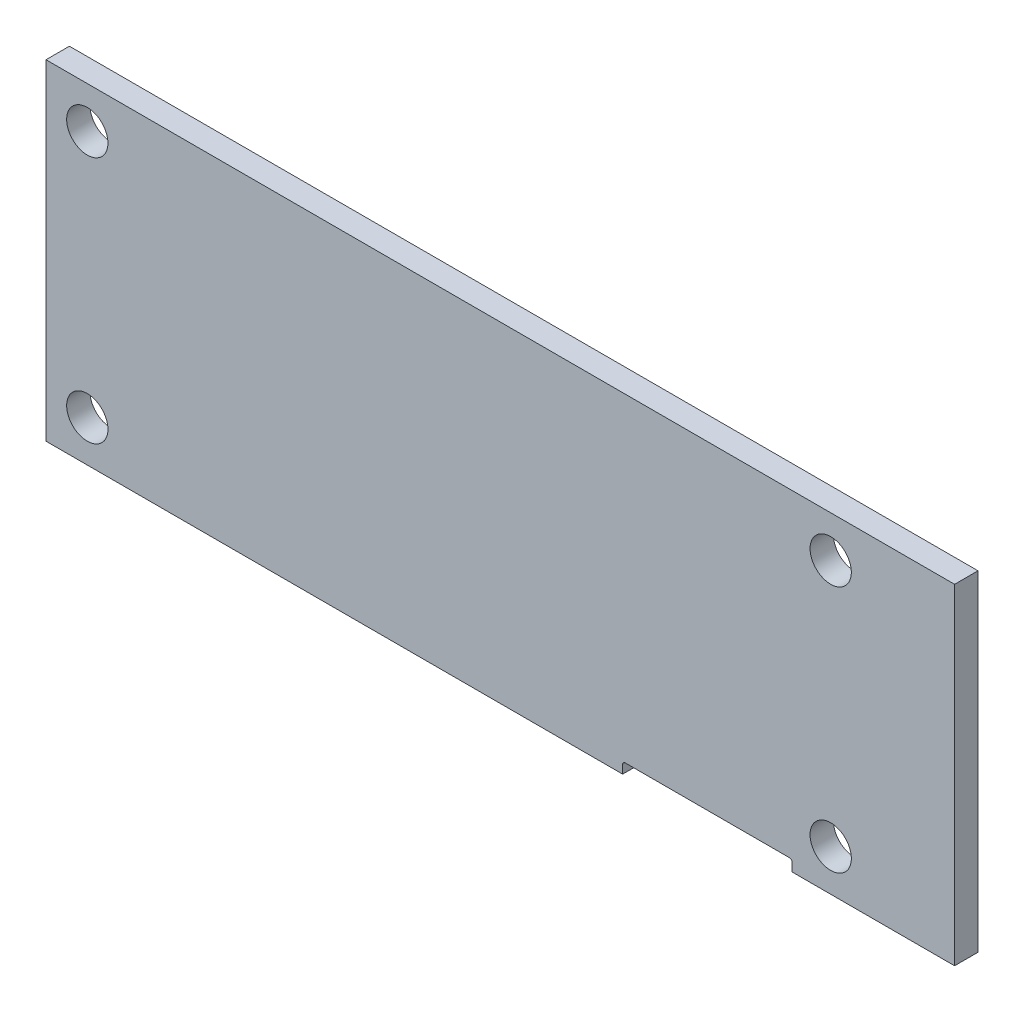
from build123d import *

# Parameters (mm, degrees)
IZIM2_W                     = 69.85
IZIM2_H                     = 25.4
IZIM2_R                     = 1.5875
Y_KSEKLIK_EKSTR_ZYON1_DEPTH = 1.8
KES_EKSTR_ZYON1_DEPTH       = 10


with BuildPart() as part:
    # Çizim2 → Yükseklik-Ekstrüzyon1 (new body)
    with BuildSketch(Plane.XY):
        with Locations((-0.661210761, 0)):
            Rectangle(IZIM2_W, IZIM2_H)
        with Locations((24.738789239, 9.525)):
            Circle(IZIM2_R, mode=Mode.SUBTRACT)
        with Locations((-32.411210761, 9.525)):
            Circle(IZIM2_R, mode=Mode.SUBTRACT)
        with Locations((-32.411210761, -9.525)):
            Circle(IZIM2_R, mode=Mode.SUBTRACT)
        with Locations((24.738789239, -9.525)):
            Circle(IZIM2_R, mode=Mode.SUBTRACT)
    extrude(amount=Y_KSEKLIK_EKSTR_ZYON1_DEPTH)

    # Çizim11 → Kes-Ekstrüzyon1 (cut)
    with BuildSketch(Plane(origin=(0, 0, 0), x_dir=(-1, 0, 0), z_dir=(0, 0, -1))):
        with BuildLine():
            Line((-21.774384468, -12.050508353), (-21.774384468, -12.7))
            Line((-21.774384468, -12.7), (-8.745798644, -12.7))
            Line((-8.745798644, -12.7), (-8.745798644, -12.050508353))
            ThreePointArc((-8.745798644, -12.050508353), (-8.804377288, -11.909086996), (-8.945798644, -11.850508353))
            Line((-8.945798644, -11.850508353), (-21.574384468, -11.850508353))
            ThreePointArc((-21.574384468, -11.850508353), (-21.715805824, -11.909086996), (-21.774384468, -12.050508353))
        make_face()
    extrude(amount=-KES_EKSTR_ZYON1_DEPTH, mode=Mode.SUBTRACT)


solid = part.part
